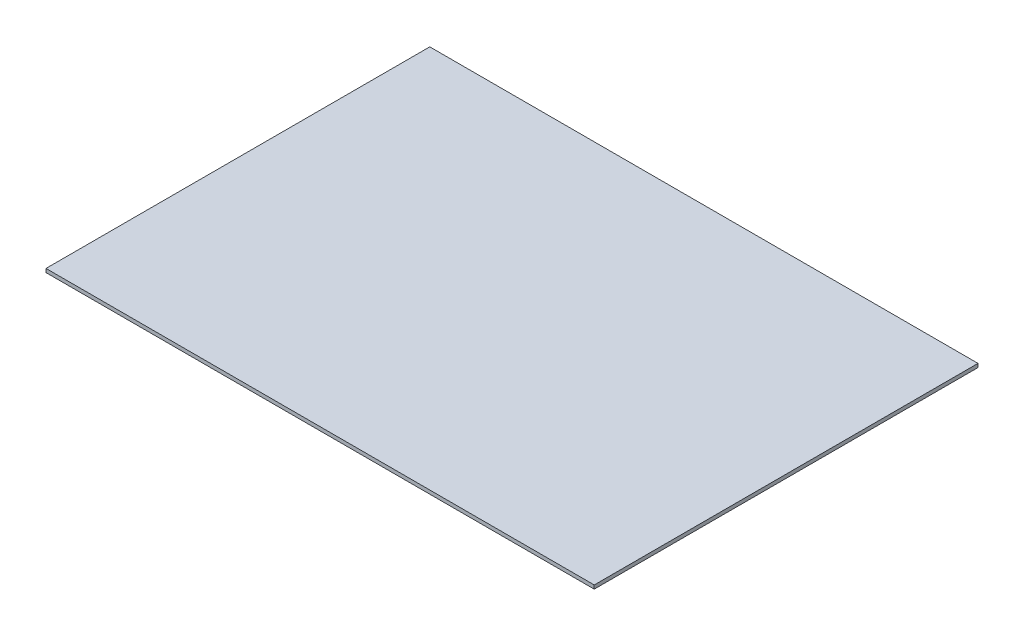
from build123d import *

# Parameters (mm, degrees)
SKETCH1_W           = 150
SKETCH1_H           = 105
BOSS_EXTRUDE1_DEPTH = 1


with BuildPart() as part:
    # Sketch1 → Boss-Extrude1 (new body)
    with BuildSketch(Plane(origin=(0, 0, 0), x_dir=(1, 0, 0), z_dir=(0, 1, 0))):
        Rectangle(SKETCH1_W, SKETCH1_H)
    extrude(amount=-BOSS_EXTRUDE1_DEPTH)


solid = part.part
